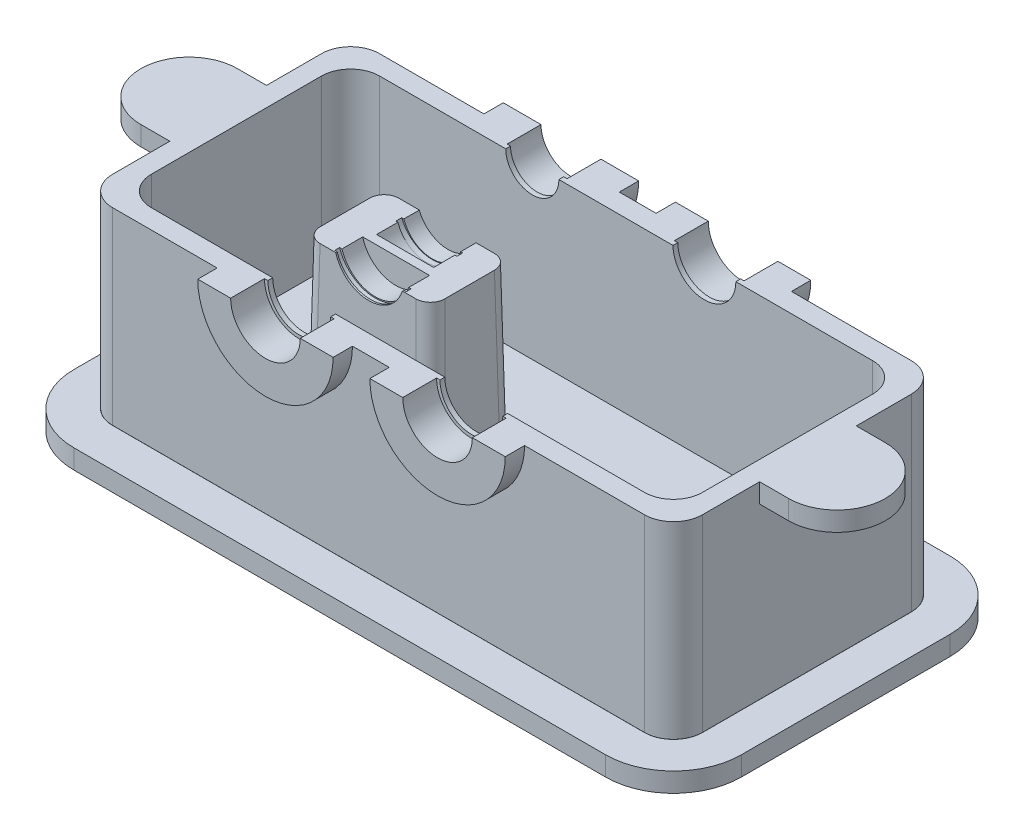
from build123d import *

# Parameters (mm, degrees)
SKETCH1_W            = 570
SKETCH1_H            = 236
BOSS_EXTRUDE1_DEPTH  = 175
SHELL1_T             = 20
SKETCH4_W            = 134.707152191
SKETCH4_H            = 87
BOSS_EXTRUDE4_DEPTH  = 163
BOSS_EXTRUDE4_TAPER  = 1
CUT_EXTRUDE4_DEPTH   = 20
SKETCH13_R           = 36
CUT_EXTRUDE5_DEPTH   = 20
SKETCH17_R           = 31
CUT_EXTRUDE6_DEPTH   = 20
CUT_EXTRUDE9_DEPTH   = 44
CUT_EXTRUDE10_DEPTH  = 28
FILLET5_R            = 30
FILLET6_R            = 30
FILLET7_R            = 30
FILLET8_R            = 30
FILLET12_R           = 15
FILLET13_R           = 15
FILLET14_R           = 15
FILLET15_R           = 15
FILLET16_R           = 30
FILLET17_R           = 30
FILLET18_R           = 30
FILLET19_R           = 30
CUT_SWEEP3_START     = -4.571690946
CUT_SWEEP3_DEPTH     = 5
BOSS_EXTRUDE6_DEPTH  = 20
SKETCH36_W           = 100
SKETCH36_H           = 100
BOSS_EXTRUDE11_DEPTH = 20
SKETCH37_W           = 100
SKETCH37_H           = 100
BOSS_EXTRUDE12_DEPTH = 20
FILLET21_RADIUS      = 50
FILLET21_LENGTH      = 20
CUT_SWEEP5_START     = -63.449777345
CUT_SWEEP5_DEPTH     = 6.07514
CUT_EXTRUDE13_START  = -20
CUT_EXTRUDE13_DEPTH  = 20
FILLET23_R           = 5
BOSS_EXTRUDE13_START = 20
BOSS_EXTRUDE13_DEPTH = 20
FILLET24_RADIUS      = 50
FILLET24_LENGTH      = 20
BOSS_EXTRUDE14_START = 20
BOSS_EXTRUDE14_DEPTH = 20
BOSS_EXTRUDE15_DEPTH = 20
BOSS_EXTRUDE16_DEPTH = 5
BOSS_EXTRUDE17_START = -5
BOSS_EXTRUDE17_DEPTH = 5
BOSS_EXTRUDE18_START = -5
BOSS_EXTRUDE18_DEPTH = 5


# Read off the part's stored shape, not the designer's step: Cut-Sweep3, Cut-Sweep5
with BuildPart() as part:
    # Sketch1 → Boss-Extrude1 (new body)
    with BuildSketch(Plane(origin=(0, 0, 0), x_dir=(1, 0, 0), z_dir=(0, 1, 0))):
        with Locations((12.971530249, 48.903914591)):
            Rectangle(SKETCH1_W, SKETCH1_H)
    extrude(amount=-BOSS_EXTRUDE1_DEPTH)

    # Shell1
    shell1_openings = [part.faces().sort_by_distance(p)[0] for p in [
        (12.971530249, 0, -48.903914591),
    ]]
    offset(amount=SHELL1_T, openings=shell1_openings, kind=Kind.INTERSECTION)

    # Sketch4 → Boss-Extrude4 (add)
    with BuildSketch(Plane(origin=(0, -175, 0), x_dir=(1, 0, 0), z_dir=(0, 1, 0))):
        with Locations((-85.157038307, 38.726515363)):
            Rectangle(SKETCH4_W, SKETCH4_H)
    extrude(amount=BOSS_EXTRUDE4_DEPTH, taper=BOSS_EXTRUDE4_TAPER)

    # Sketch12 → Cut-Extrude4 (cut)
    with BuildSketch(Plane.XY.offset(89.096085409)):
        with BuildLine():
            Line((-120.028469751, 0), (-48.028469751, 0))
            ThreePointArc((-48.028469751, 0), (-84.028469751, -36), (-120.028469751, 0))
        make_face()
    extrude(amount=-CUT_EXTRUDE4_DEPTH, mode=Mode.SUBTRACT)

    # Sketch13 → Cut-Extrude5 (cut)
    with BuildSketch(Plane.XY.offset(89.096085409)):
        with Locations((93.971530249, 0)):
            Circle(SKETCH13_R)
    extrude(amount=-CUT_EXTRUDE5_DEPTH, mode=Mode.SUBTRACT)

    # Sketch17 → Cut-Extrude6 (cut)
    with BuildSketch(Plane(origin=(0, 0, -186.903914591), x_dir=(-1, 0, 0), z_dir=(0, 0, -1))):
        with Locations((84.028469751, 0)):
            Circle(SKETCH17_R)
    extrude(amount=-CUT_EXTRUDE6_DEPTH, mode=Mode.SUBTRACT)

    # Sketch22 → Cut-Extrude9 (cut)
    with BuildSketch(Plane(origin=(0, 1.381529365, -79.147764315), x_dir=(-1, 0, 0), z_dir=(0, 0.01745240643728355, -0.9998476951563913))):
        with BuildLine():
            Line((115.028469751, -3.261923082), (53.028469751, -3.261923082))
            ThreePointArc((53.028469751, -3.261923082), (84.028469751, -34.261923082), (115.028469751, -3.261923082))
        make_face()
    extrude(amount=-CUT_EXTRUDE9_DEPTH, mode=Mode.SUBTRACT)

    # Sketch23 → Cut-Extrude10 (cut)
    with BuildSketch(Plane(origin=(0, 0.02999347, 1.718324737), x_dir=(1, 0, 0), z_dir=(0, 0.01745240643728355, 0.9998476951563913))):
        with BuildLine():
            Line((-48.028469751, -1.554941095), (-120.028469751, -1.554941095))
            ThreePointArc((-120.028469751, -1.554941095), (-84.028469751, -37.554941095), (-48.028469751, -1.554941095))
        make_face()
    extrude(amount=-CUT_EXTRUDE10_DEPTH, mode=Mode.SUBTRACT)

    # Fillet5
    fillet5_edges = [part.edges().sort_by_distance(p)[0] for p in [
        (-272.028469751, -87.5, -166.903914591),
    ]]
    fillet(fillet5_edges, radius=FILLET5_R)

    # Fillet6
    fillet6_edges = [part.edges().sort_by_distance(p)[0] for p in [
        (-272.028469751, -87.5, 69.096085409),
    ]]
    fillet(fillet6_edges, radius=FILLET6_R)

    # Fillet7
    fillet7_edges = [part.edges().sort_by_distance(p)[0] for p in [
        (297.971530249, -87.5, -166.903914591),
    ]]
    fillet(fillet7_edges, radius=FILLET7_R)

    # Fillet8
    fillet8_edges = [part.edges().sort_by_distance(p)[0] for p in [
        (297.971530249, -87.5, 69.096085409),
    ]]
    fillet(fillet8_edges, radius=FILLET8_R)

    # Fillet12
    fillet12_edges = [part.edges().sort_by_distance(p)[0] for p in [
        (-19.226050003, -93.5, 3.350896846),
    ]]
    fillet(fillet12_edges, radius=FILLET12_R)

    # Fillet13
    fillet13_edges = [part.edges().sort_by_distance(p)[0] for p in [
        (-19.226050003, -93.5, -80.803927571),
    ]]
    fillet(fillet13_edges, radius=FILLET13_R)

    # Fillet14
    fillet14_edges = [part.edges().sort_by_distance(p)[0] for p in [
        (-151.08802661, -93.5, -80.803927571),
    ]]
    fillet(fillet14_edges, radius=FILLET14_R)

    # Fillet15
    fillet15_edges = [part.edges().sort_by_distance(p)[0] for p in [
        (-151.08802661, -93.5, 3.350896846),
    ]]
    fillet(fillet15_edges, radius=FILLET15_R)

    # Fillet16
    fillet16_edges = [part.edges().sort_by_distance(p)[0] for p in [
        (-292.028469751, -97.5, 89.096085409),
    ]]
    fillet(fillet16_edges, radius=FILLET16_R)

    # Fillet17
    fillet17_edges = [part.edges().sort_by_distance(p)[0] for p in [
        (-292.028469751, -97.5, -186.903914591),
    ]]
    fillet(fillet17_edges, radius=FILLET17_R)

    # Fillet18
    fillet18_edges = [part.edges().sort_by_distance(p)[0] for p in [
        (317.971530249, -97.5, -186.903914591),
    ]]
    fillet(fillet18_edges, radius=FILLET18_R)

    # Fillet19
    fillet19_edges = [part.edges().sort_by_distance(p)[0] for p in [
        (317.971530249, -97.5, 89.096085409),
    ]]
    fillet(fillet19_edges, radius=FILLET19_R)

    # Cut-Sweep3 outline → Cut-Sweep3 (cut)
    with BuildSketch(Plane.XY.offset(CUT_SWEEP3_START)):
        with BuildLine():
            add(Edge.make_bspline(
                [(-47.052477441, -11.999974845), (-47.302192564, -12.769505517), (-47.575910058, -13.531253667), (-49.540666001, -18.50448736), (-51.954288586, -22.429256847), (-57.983127077, -29.214119619), (-61.596840525, -32.072522046), (-69.587626352, -36.377007876), (-73.962707322, -37.822018545), (-82.945318093, -39.123540773), (-87.550609312, -38.979727975), (-96.434510003, -37.120275125), (-100.710905492, -35.405098473), (-108.417544986, -30.61041766), (-111.845868396, -27.532108396), (-117.439621125, -20.384298466), (-119.603511161, -16.317026683), (-121.004534252, -12)],
                knots=[0.091604094, 0.091604094, 0.091604094, 0.091604094, 0.111478319, 0.111478319, 0.222956638, 0.222956638, 0.334434957, 0.334434957, 0.445913276, 0.445913276, 0.557391595, 0.557391595, 0.668869914, 0.668869914, 0.780348233, 0.780348233, 0.891826552, 0.891826552, 0.891826552, 0.891826552], degree=3))
            Line((-47.052477441, -11.999974845), (-121.004534252, -12))
        make_face()
    extrude(amount=CUT_SWEEP3_DEPTH, mode=Mode.SUBTRACT)

    # Sketch36 → Boss-Extrude11 (add)
    with BuildSketch(Plane(origin=(0, 0, 0), x_dir=(1, 0, 0), z_dir=(0, 1, 0))):
        with Locations((347.971530249, 50)):
            Rectangle(SKETCH36_W, SKETCH36_H)
    extrude(amount=-BOSS_EXTRUDE11_DEPTH)

    # Sketch37 → Boss-Extrude12 (add)
    with BuildSketch(Plane(origin=(0, 0, 0), x_dir=(1, 0, 0), z_dir=(0, 1, 0))):
        with Locations((-322.028469751, 50)):
            Rectangle(SKETCH37_W, SKETCH37_H)
    extrude(amount=-BOSS_EXTRUDE12_DEPTH)

    # Fillet21: full round fillet: the end face becomes a half cylinder, R = half its width
    fillet21_face = Plane((397.971530249, -10, -50), x_dir=(0, 1, 0), z_dir=(1, 0, 0))  # on the end face: x along it, z out of the body
    fillet21_slab = fillet21_face.offset(-FILLET21_RADIUS / 2) * Box(FILLET21_LENGTH, 2 * FILLET21_RADIUS, FILLET21_RADIUS, mode=Mode.PRIVATE)  # the body's end, R deep
    fillet21_round = Plane((347.971530249, -10, -50), x_dir=(1, 0, 0), z_dir=(0, 1, 0)) * Cylinder(FILLET21_RADIUS, FILLET21_LENGTH, mode=Mode.PRIVATE)  # its axis R under the face
    add(fillet21_slab - fillet21_round, mode=Mode.SUBTRACT)

    # Cut-Sweep5 outline → Cut-Sweep5 (cut)
    with BuildSketch(Plane.XY.offset(CUT_SWEEP5_START)):
        with BuildLine():
            add(Edge.make_bspline(
                [(-52.489869857, -12), (-53.862056708, -15.606404338), (-55.858124377, -18.973695794), (-60.868009576, -24.842756993), (-63.880547021, -27.34283636), (-70.572506519, -31.185037182), (-74.250393621, -32.526277342), (-81.844750711, -33.893964974), (-85.759478764, -33.920098737), (-93.371418867, -32.653924609), (-97.06688495, -31.361907143), (-103.809544902, -27.60939254), (-106.855192191, -25.149756125), (-111.942988201, -19.348104565), (-113.983969928, -16.00742014), (-115.459325588, -12.280355884), (-115.513668595, -12.140343292), (-115.567072952, -11.999974492)],
                knots=[0.126522069, 0.126522069, 0.126522069, 0.126522069, 0.23570681, 0.23570681, 0.344891552, 0.344891552, 0.454076293, 0.454076293, 0.563261034, 0.563261034, 0.672445776, 0.672445776, 0.781630517, 0.781630517, 0.890815259, 0.890815259, 0.895065377, 0.895065377, 0.895065377, 0.895065377], degree=3))
            Line((-52.489869857, -12), (-115.567072952, -11.999974492))
        make_face()
    extrude(amount=CUT_SWEEP5_DEPTH, mode=Mode.SUBTRACT)

    # Sketch43 → Cut-Extrude13 (cut)
    with BuildSketch(Plane(origin=(0, 0, -186.903914591), x_dir=(-1, 0, 0), z_dir=(0, 0, -1)).offset(CUT_EXTRUDE13_START)):
        with BuildLine():
            Line((-57.971530249, 0), (-129.971530249, 0))
            ThreePointArc((-129.971530249, 0), (-93.971530249, -36), (-57.971530249, 0))
        make_face()
    extrude(amount=CUT_EXTRUDE13_DEPTH, mode=Mode.SUBTRACT)

    # Fillet23
    fillet23_edges = [part.edges().sort_by_distance(p)[0] for p in [
        (-17.803462211, -175, -38.726515363),
        (-22.195914272, -175, 0.381032532),
        (-85.157038307, -175, -82.226515363),
        (-22.195914272, -175, -77.834063257),
        (-152.510614402, -175, -38.726515363),
        (-148.118162296, -175, -77.834063302),
        (-85.157038307, -175, 4.773484637),
        (-148.118162341, -175, 0.381032532),
    ]]
    fillet(fillet23_edges, radius=FILLET23_R)

    # Sketch48 → Boss-Extrude13 (add)
    with BuildSketch(Plane.XY.offset(89.096085409).offset(BOSS_EXTRUDE13_START)):
        with BuildLine():
            Line((-154.028469751, 0), (-120.028469751, 0))
            ThreePointArc((-120.028469751, 0), (-84.028469751, -36), (-48.028469751, 0))
            Line((-48.028469751, 0), (-14.028469751, 0))
            ThreePointArc((-14.028469751, 0), (-84.028469751, -70), (-154.028469751, 0))
        make_face()
    extrude(amount=-BOSS_EXTRUDE13_DEPTH)

    # Fillet24: full round fillet: the end face becomes a half cylinder, R = half its width
    fillet24_face = Plane((-372.028469751, -10, -50), x_dir=(0, 1, 0), z_dir=(-1, 0, 0))  # on the end face: x along it, z out of the body
    fillet24_slab = fillet24_face.offset(-FILLET24_RADIUS / 2) * Box(FILLET24_LENGTH, 2 * FILLET24_RADIUS, FILLET24_RADIUS, mode=Mode.PRIVATE)  # the body's end, R deep
    fillet24_round = Plane((-322.028469751, -10, -50), x_dir=(-1, 0, 0), z_dir=(0, 1, 0)) * Cylinder(FILLET24_RADIUS, FILLET24_LENGTH, mode=Mode.PRIVATE)  # its axis R under the face
    add(fillet24_slab - fillet24_round, mode=Mode.SUBTRACT)

    # Sketch49 → Boss-Extrude14 (add)
    with BuildSketch(Plane.XY.offset(89.096085409).offset(BOSS_EXTRUDE14_START)):
        with BuildLine():
            Line((163.971530249, 0), (129.971530249, 0))
            ThreePointArc((129.971530249, 0), (93.971530249, -36), (57.971530249, 0))
            Line((57.971530249, 0), (23.971530249, 0))
            ThreePointArc((23.971530249, 0), (93.971530249, -70), (163.971530249, 0))
        make_face()
    boss_extrude14 = extrude(amount=-BOSS_EXTRUDE14_DEPTH)

    # Mirror1: Boss-Extrude14 across plane
    add(boss_extrude14.mirror(Plane(origin=(0, 0, -48.903914591), x_dir=(1, 0, 0), z_dir=(0, 0, -1))))

    # Sketch52 → Boss-Extrude15 (add)
    with BuildSketch(Plane(origin=(0, 0, -186.903914591), x_dir=(-1, 0, 0), z_dir=(0, 0, -1))):
        with BuildLine():
            Line((154.028469751, 0), (115.028469751, 0))
            ThreePointArc((115.028469751, 0), (84.028469751, -31), (53.028469751, 0))
            Line((53.028469751, 0), (14.028469751, 0))
            ThreePointArc((14.028469751, 0), (84.028469751, -70), (154.028469751, 0))
        make_face()
    extrude(amount=BOSS_EXTRUDE15_DEPTH)

    # Sketch53 → Boss-Extrude16 (add)
    with BuildSketch(Plane.XY.offset(-166.903914591)):
        with BuildLine():
            Line((57.971530249, 0), (61.471530249, 0))
            ThreePointArc((61.471530249, 0), (93.971530249, -32.5), (126.471530249, 0))
            Line((126.471530249, 0), (129.971530249, 0))
            ThreePointArc((129.971530249, 0), (93.971530249, -36), (57.971530249, 0))
        make_face()
    boss_extrude16 = extrude(amount=-BOSS_EXTRUDE16_DEPTH)

    # Mirror2: Boss-Extrude16 across plane
    add(boss_extrude16.mirror(Plane(origin=(0, 0, -48.903914591), x_dir=(1, 0, 0), z_dir=(0, 0, -1))))

    # Sketch54 → Boss-Extrude17 (add)
    with BuildSketch(Plane.XY.offset(-166.903914591).offset(BOSS_EXTRUDE17_START)):
        with BuildLine():
            Line((-53.028469751, 0), (-56.528469751, 0))
            ThreePointArc((-56.528469751, 0), (-84.028469751, -27.5), (-111.528469751, 0))
            Line((-111.528469751, 0), (-115.028469751, 0))
            ThreePointArc((-115.028469751, 0), (-84.028469751, -31), (-53.028469751, 0))
        make_face()
    extrude(amount=BOSS_EXTRUDE17_DEPTH)

    # Sketch55 → Boss-Extrude18 (add)
    with BuildSketch(Plane(origin=(0, 0, 69.096085409), x_dir=(-1, 0, 0), z_dir=(0, 0, -1)).offset(BOSS_EXTRUDE18_START)):
        with BuildLine():
            Line((48.028469751, 0), (51.528469751, 0))
            ThreePointArc((51.528469751, 0), (84.028469751, -32.5), (116.528469751, 0))
            Line((116.528469751, 0), (120.028469751, 0))
            ThreePointArc((120.028469751, 0), (84.028469751, -36), (48.028469751, 0))
        make_face()
    extrude(amount=BOSS_EXTRUDE18_DEPTH)


with BuildPart() as body_2:
    # Sketch30 → Boss-Extrude6 (new body)
    with BuildSketch(Plane.XZ.offset(195)):
        with BuildLine():
            Line((287.971530249, 129.196085409), (-262.028469751, 129.196085409))
            ThreePointArc((-262.028469751, 129.196085409), (-311.596655112, 108.66427077), (-332.128469751, 59.096085409))
            Line((-332.128469751, 59.096085409), (-332.128469751, -156.903914591))
            ThreePointArc((-332.128469751, -156.903914591), (-311.596655112, -206.472099952), (-262.028469751, -227.003914591))
            Line((-262.028469751, -227.003914591), (287.971530249, -227.003914591))
            ThreePointArc((287.971530249, -227.003914591), (337.53971561, -206.472099952), (358.071530249, -156.903914591))
            Line((358.071530249, -156.903914591), (358.071530249, 59.096085409))
            ThreePointArc((358.071530249, 59.096085409), (337.53971561, 108.66427077), (287.971530249, 129.196085409))
        make_face()
        with BuildLine():
            Line((318.071530249, -156.903914591), (318.071530249, 59.096085409))
            ThreePointArc((318.071530249, 59.096085409), (309.255444363, 80.379999523), (287.971530249, 89.196085409))
            Line((287.971530249, 89.196085409), (-262.028469751, 89.196085409))
            ThreePointArc((-262.028469751, 89.196085409), (-283.312383865, 80.379999523), (-292.128469751, 59.096085409))
            Line((-292.128469751, 59.096085409), (-292.128469751, -156.903914591))
            ThreePointArc((-292.128469751, -156.903914591), (-283.312383865, -178.187828704), (-262.028469751, -187.003914591))
            Line((-262.028469751, -187.003914591), (287.971530249, -187.003914591))
            ThreePointArc((287.971530249, -187.003914591), (309.255444363, -178.187828704), (318.071530249, -156.903914591))
        make_face(mode=Mode.SUBTRACT)
    extrude(amount=BOSS_EXTRUDE6_DEPTH)


solid = Compound([part.part, body_2.part])
